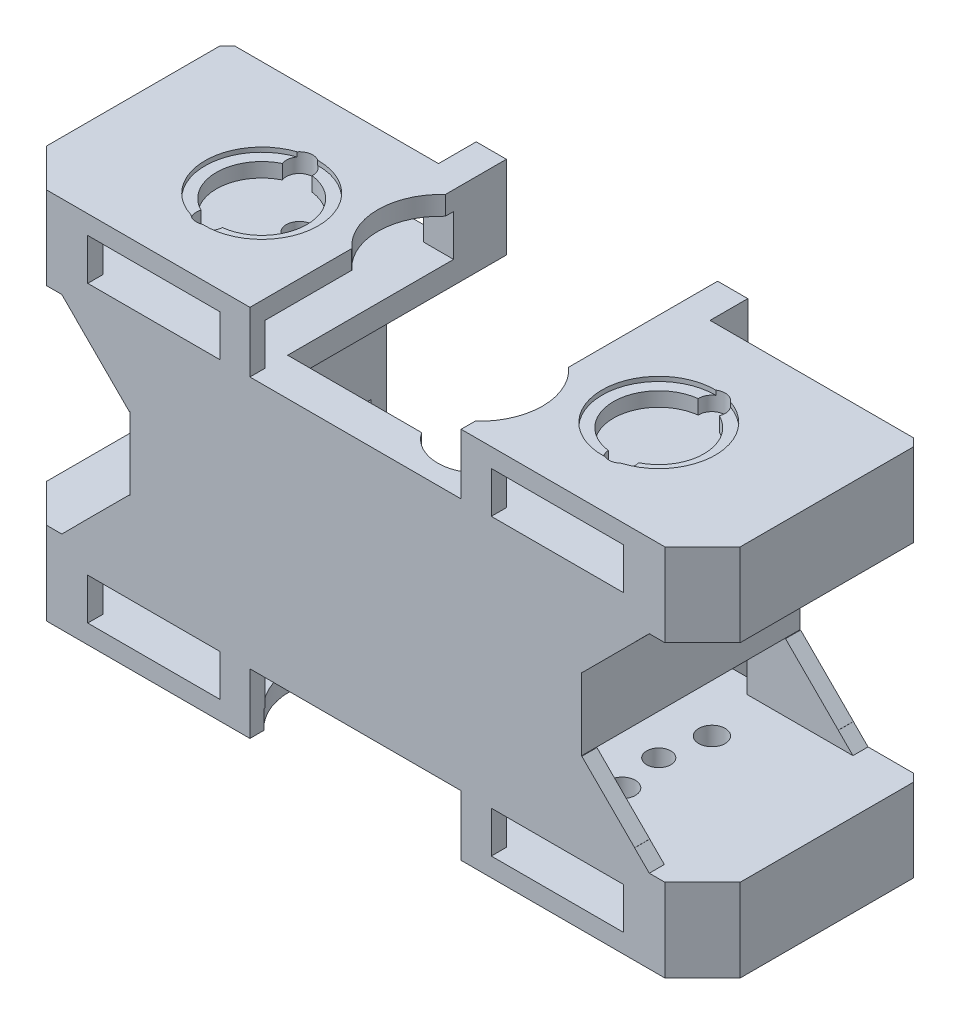
from build123d import *
from build123d.topology import SkipClean

# Parameters (mm, degrees)
BOSS_EXTRUDE1_DEPTH       = 2
BOSS_EXTRUDE2_DEPTH       = 25
BOSS_EXTRUDE2_DEPTH_BACK  = 2
SKETCH2_W                 = 4.4
SKETCH2_H                 = 9.5
SKETCH2_W_2               = 5
SKETCH2_H_2               = 9.59
SKETCH3_W                 = 23
SKETCH3_H                 = 13
SKETCH3_W_2               = 17.5
SKETCH3_H_2               = 6.5
BOSS_EXTRUDE3_DEPTH       = 2
SKETCH4_W                 = 23
SKETCH4_H                 = 2.5
SKETCH4_W_2               = 32
SKETCH4_H_2               = 3
BOSS_EXTRUDE4_DEPTH       = 27
BOSS_EXTRUDE5_DEPTH       = 2
CHAMFER5_SIZE             = 5
CHAMFER6_SIZE             = 7
BOSS_EXTRUDE6_DEPTH       = 5.5
BOSS_EXTRUDE7_DEPTH       = 2.5
SKETCH8_W                 = 26
SKETCH8_H                 = 5.5
CUT_EXTRUDE1_DEPTH        = 59.801041657
BOSS_EXTRUDE8_DEPTH       = 5.5
BOSS_EXTRUDE9_DEPTH       = 2.5
SKETCH11_W                = 26
SKETCH11_H                = 5.5
CUT_EXTRUDE2_DEPTH        = 2
SKETCH12_R                = 0.75
CUT_EXTRUDE3_DEPTH        = 5
CUT_EXTRUDE4_START        = -5
SKETCH13_R                = 0.75
CUT_EXTRUDE4_DEPTH        = 5
CHAMFER7_SIZE             = 1.94
SKETCH14_R                = 0.75
CUT_EXTRUDE5_DEPTH        = 5
CUT_EXTRUDE6_START        = -5
SKETCH15_R                = 0.75
CUT_EXTRUDE6_DEPTH        = 5
CUT_EXTRUDE7_REACH        = 74.768
SKETCH16_R                = 1.75
CUT_EXTRUDE8_START        = -11
SKETCH17_R                = 1.75
CUT_EXTRUDE8_DEPTH        = 11
CUT_EXTRUDE9_DEPTH        = 59.801041657
SKETCH19_R                = 6
CUT_EXTRUDE10_DEPTH       = 5
CUT_EXTRUDE11_START       = -5
SKETCH20_R                = 6
CUT_EXTRUDE11_DEPTH       = 5
SKETCH21_R                = 1.6
CUT_EXTRUDE12_DEPTH       = 5
CUT_EXTRUDE13_START       = -5
SKETCH22_R                = 1.6
CUT_EXTRUDE13_DEPTH       = 5
SKETCH24_R                = 7.5
CUT_EXTRUDE15_DEPTH       = 0.6
CUT_EXTRUDE16_START       = -0.6
SKETCH25_R                = 7.5
CUT_EXTRUDE16_DEPTH       = 0.6
SKETCH28_W                = 4
SKETCH28_H                = 11
BOSS_EXTRUDE12_DEPTH      = 5
SKETCH29_R                = 0.75
CUT_EXTRUDE17_DEPTH       = 5
CHAMFER9_SIZE             = 3
CHAMFER10_SIZE            = 1
SKETCH30_W                = 4.4
SKETCH30_H                = 9.5
CUT_EXTRUDE18_DEPTH       = 1
CUT_EXTRUDE19_DEPTH       = 2.5
CUT_EXTRUDE20_DEPTH       = 2.5
SKETCH33_W                = 4.4
SKETCH33_H                = 9.5
CUT_EXTRUDE21_DEPTH       = 24
BOSS_EXTRUDE13_DEPTH      = 3
BOSS_EXTRUDE13_DEPTH_BACK = 2
SKETCH34_W                = 28
SKETCH34_H                = 3
SKETCH35_R                = 5.5
CUT_EXTRUDE22_DEPTH       = 68.987131135
SKETCH36_R                = 5.5
CUT_EXTRUDE23_DEPTH       = 3


with BuildPart() as part:
    # Sketch1 → Boss-Extrude1 (new body)
    with BuildSketch(Plane.XY):
        Polygon((-37, 13.75), (37, 13.75), (37, 4.795), (24.925, 4.795), (24.925, -4.795), (37, -4.795), (37, -13.75), (-37, -13.75), (-37, -4.795), (-24.925, -4.795), (-24.925, 4.795), (-37, 4.795), align=None)
    extrude(amount=BOSS_EXTRUDE1_DEPTH)

    # Sketch2 → Boss-Extrude2 (add, two sides: drawn at the far end of the back side and taken through both)
    with BuildSketch(Plane(origin=(0, 0, 0), x_dir=(-1, 0, 0), z_dir=(0, 0, -1)).offset(-BOSS_EXTRUDE2_DEPTH_BACK)):
        Rectangle(SKETCH2_W, SKETCH2_H)
        with Locations((27.425, 0)):
            Rectangle(SKETCH2_W_2, SKETCH2_H_2)
        with Locations((-27.425, 0)):
            Rectangle(SKETCH2_W_2, SKETCH2_H_2)
    extrude(amount=BOSS_EXTRUDE2_DEPTH + BOSS_EXTRUDE2_DEPTH_BACK)

    # Sketch3 → Boss-Extrude3 (add)
    # profile 1 of 4: a face of its own
    with BuildSketch(Plane.XY.offset(2)):
        with Locations((-25.5, 18.25)):
            Rectangle(SKETCH3_W, SKETCH3_H)
        with Locations((-26.75, 19)):
            Rectangle(SKETCH3_W_2, SKETCH3_H_2, mode=Mode.SUBTRACT)
    # profile 2 of 4: a face of its own
    with BuildSketch(Plane.XY.offset(2)):
        with Locations((25.5, 18.25)):
            Rectangle(SKETCH3_W, SKETCH3_H)
        with Locations((26.75, 19)):
            Rectangle(SKETCH3_W_2, SKETCH3_H_2, mode=Mode.SUBTRACT)
    # profile 3 of 4: a face of its own
    with BuildSketch(Plane.XY.offset(2)):
        with Locations((25.5, -18.25)):
            Rectangle(SKETCH3_W, SKETCH3_H)
        with Locations((26.75, -19)):
            Rectangle(SKETCH3_W_2, SKETCH3_H_2, mode=Mode.SUBTRACT)
    # profile 4 of 4: a face of its own
    with BuildSketch(Plane.XY.offset(2)):
        with Locations((-25.5, -18.25)):
            Rectangle(SKETCH3_W, SKETCH3_H)
        with Locations((-26.75, -19)):
            Rectangle(SKETCH3_W_2, SKETCH3_H_2, mode=Mode.SUBTRACT)
    extrude(amount=-BOSS_EXTRUDE3_DEPTH)

    # Sketch4 → Boss-Extrude4 (add)
    with BuildSketch(Plane.XY.offset(2)):
        with Locations((25.5, 23.5)):
            Rectangle(SKETCH4_W, SKETCH4_H)
        with Locations((30, 15.25)):
            Rectangle(SKETCH4_W_2, SKETCH4_H_2)
        with Locations((-30, 15.25)):
            Rectangle(SKETCH4_W_2, SKETCH4_H_2)
        with Locations((-25.5, 23.5)):
            Rectangle(SKETCH4_W, SKETCH4_H)
        with Locations((-25.5, -23.5)):
            Rectangle(SKETCH4_W, SKETCH4_H)
        with Locations((25.5, -23.5)):
            Rectangle(SKETCH4_W, SKETCH4_H)
        with Locations((-30, -15.25)):
            Rectangle(SKETCH4_W_2, SKETCH4_H_2)
        with Locations((30, -15.25)):
            Rectangle(SKETCH4_W_2, SKETCH4_H_2)
    extrude(amount=-BOSS_EXTRUDE4_DEPTH)

    # Sketch5 → Boss-Extrude5 (add)
    with BuildSketch(Plane(origin=(0, 0, -25), x_dir=(-1, 0, 0), z_dir=(0, 0, -1))):
        Polygon((14, -13.75), (14, -24.75), (37, -24.75), (37, -16.75), (46, -16.75), (46, -13.75), (37, -13.75), (37, -4.795), (29.925, -4.795), (29.925, 4.795), (37, 4.795), (37, 13.75), (46, 13.75), (46, 16.75), (37, 16.75), (37, 24.75), (14, 24.75), (14, 13.75), (-14, 13.75), (-14, 24.75), (-37, 24.75), (-37, 16.75), (-46, 16.75), (-46, 13.75), (-37, 13.75), (-37, 4.795), (-29.925, 4.795), (-29.925, -4.795), (-37, -4.795), (-37, -13.75), (-46, -13.75), (-46, -16.75), (-37, -16.75), (-37, -24.75), (-14, -24.75), (-14, -13.75), align=None)
    extrude(amount=BOSS_EXTRUDE5_DEPTH)

    # Chamfer5
    chamfer5_edges = [part.edges().sort_by_distance(p)[0] for p in [
        (-46, 15.25, 2),
        (46, 15.25, 2),
        (46, -15.25, 2),
        (-46, -15.25, 2),
    ]]
    chamfer(chamfer5_edges, length=CHAMFER5_SIZE)

    # Chamfer6
    chamfer6_edges = [part.edges().sort_by_distance(p)[0] for p in [
        (37, 4.795, 1),
        (37, -4.795, 1),
        (-37, -4.795, 1),
        (-37, 4.795, 1),
        (-37, -4.795, -26),
        (-37, 4.795, -26),
        (37, 4.795, -26),
        (37, -4.795, -26),
    ]]
    chamfer(chamfer6_edges, length=CHAMFER6_SIZE)

    # Sketch6 → Boss-Extrude6 (add)
    with BuildSketch(Plane(origin=(0, 16.75, 0), x_dir=(1, 0, 0), z_dir=(0, 1, 0))):
        Polygon((-37, 0), (-37, -2), (-41, -2), (-46, 3), (-46, 27), (-37, 27), (-37, 25), (-44, 25), (-44, 3.828427125), (-40.171572875, 0), align=None)
        Polygon((40.171572875, 0), (37, 0), (37, -2), (41, -2), (46, 3), (46, 27), (37, 27), (37, 25), (44, 25), (44, 3.828427125), align=None)
    extrude(amount=BOSS_EXTRUDE6_DEPTH)

    # Sketch7 → Boss-Extrude7 (add)
    with BuildSketch(Plane(origin=(0, 22.25, 0), x_dir=(1, 0, 0), z_dir=(0, 1, 0))):
        Polygon((-46, 3), (-46, 27), (-37, 27), (-37, -2), (-41, -2), align=None)
        Polygon((46, 3), (41, -2), (37, -2), (37, 27), (46, 27), align=None)
    extrude(amount=BOSS_EXTRUDE7_DEPTH)

    # Sketch8 → Cut-Extrude1 (cut, through all)
    with BuildSketch(Plane.XY.offset(-25)):
        with Locations((-31, 19.5)):
            Rectangle(SKETCH8_W, SKETCH8_H)
        with Locations((31, 19.5)):
            Rectangle(SKETCH8_W, SKETCH8_H)
    extrude(amount=-CUT_EXTRUDE1_DEPTH, mode=Mode.SUBTRACT)

    # Sketch9 → Boss-Extrude8 (add)
    with BuildSketch(Plane.XZ.offset(16.75)):
        Polygon((41, 2), (37, 2), (37, 0), (40.171572875, 0), (44, -3.828427125), (44, -25), (37, -25), (37, -27), (46, -27), (46, -3), align=None)
        Polygon((-41, 2), (-46, -3), (-46, -27), (-37, -27), (-37, -25), (-44, -25), (-44, -3.828427125), (-40.171572875, 0), (-37, 0), (-37, 2), align=None)
    extrude(amount=BOSS_EXTRUDE8_DEPTH)

    # Sketch10 → Boss-Extrude9 (add)
    with BuildSketch(Plane.XZ.offset(22.25)):
        Polygon((46, -3), (41, 2), (37, 2), (37, -27), (46, -27), align=None)
        Polygon((-46, -3), (-46, -27), (-37, -27), (-37, 2), (-41, 2), align=None)
    extrude(amount=BOSS_EXTRUDE9_DEPTH)

    # Sketch11 → Cut-Extrude2 (cut)
    with BuildSketch(Plane(origin=(0, 0, -27), x_dir=(-1, 0, 0), z_dir=(0, 0, -1))):
        with Locations((31, -19.5)):
            Rectangle(SKETCH11_W, SKETCH11_H)
        with Locations((-31, -19.5)):
            Rectangle(SKETCH11_W, SKETCH11_H)
    extrude(amount=-CUT_EXTRUDE2_DEPTH, mode=Mode.SUBTRACT)

    # Sketch12 → Cut-Extrude3 (cut)
    with BuildSketch(Plane.XZ.offset(4.75)):
        with Locations(Location((-0.16, -17.91, 0), (0, 0, 270))):
            Circle(SKETCH12_R)
        with Locations(Location((0.16, -6, 0), (0, 0, 270))):
            Circle(SKETCH12_R)
    extrude(amount=-CUT_EXTRUDE3_DEPTH, mode=Mode.SUBTRACT)

    # Sketch13 → Cut-Extrude4 (cut)
    with BuildSketch(Plane(origin=(0, 4.75, 0), x_dir=(1, 0, 0), z_dir=(0, 1, 0)).offset(CUT_EXTRUDE4_START)):
        with Locations(Location((0.16, 6, 0), (0, 0, 90))):
            Circle(SKETCH13_R)
        with Locations(Location((-0.16, 17.91, 0), (0, 0, 90))):
            Circle(SKETCH13_R)
    extrude(amount=CUT_EXTRUDE4_DEPTH, mode=Mode.SUBTRACT)

    # Chamfer7
    chamfer7_edges = [part.edges().sort_by_distance(p)[0] for p in [
        (-37, 13.75, 1),
        (37, 13.75, 1),
        (37, -13.75, 1),
        (-37, -13.75, 1),
        (-37, -13.75, -26),
        (-37, 13.75, -26),
        (37, 13.75, -26),
        (37, -13.75, -26),
    ]]
    chamfer(chamfer7_edges, length=CHAMFER7_SIZE)

    # Sketch14 → Cut-Extrude5 (cut)
    with BuildSketch(Plane(origin=(0, 4.795, 0), x_dir=(1, 0, 0), z_dir=(0, 1, 0))):
        with Locations(Location((27.34, 6, 0), (0, 0, 180))):
            Circle(SKETCH14_R)
        with Locations(Location((27.34, 17.91, 0), (0, 0, 180))):
            Circle(SKETCH14_R)
        with Locations((-27.34, 17.91)):
            Circle(SKETCH14_R)
        with Locations((-27.34, 6)):
            Circle(SKETCH14_R)
    extrude(amount=-CUT_EXTRUDE5_DEPTH, mode=Mode.SUBTRACT)

    # Sketch15 → Cut-Extrude6 (cut)
    with SkipClean():  # the faces are left unmerged after this step: merging them gives an invalid solid
        with BuildSketch(Plane.XZ.offset(4.795).offset(CUT_EXTRUDE6_START)):
            with Locations(Location((27.34, -17.91, 0), (0, 0, 180))):
                Circle(SKETCH15_R)
            with Locations(Location((27.34, -6, 0), (0, 0, 180))):
                Circle(SKETCH15_R)
            with Locations(Location((-27.34, -6, 0), (0, 0, 180))):
                Circle(SKETCH15_R)
            with Locations(Location((-27.34, -17.91, 0), (0, 0, 180))):
                Circle(SKETCH15_R)
        extrude(amount=CUT_EXTRUDE6_DEPTH, mode=Mode.SUBTRACT)
    add(part.part.scale(1), mode=Mode.REPLACE)  # the faces are merged on a copy

    # Cut-Extrude7: up to this face of the body (flat: up to its plane)
    cut_extrude7_end = Plane(part.part.faces().sort_by_distance((-30.212060379, 13.75, -12.696651711))[0])
    # Sketch16 → Cut-Extrude7 (cut, up to the picked face)
    with BuildSketch(Plane(origin=(0, 24.75, 0), x_dir=(1, 0, 0), z_dir=(0, 1, 0)), mode=Mode.PRIVATE) as cut_extrude7_sk1:
        with Locations(Location((27.34, 17.91, 0), (0, 0, 270))):
            Circle(SKETCH16_R)
    cut_extrude7_tool1 = split(extrude(cut_extrude7_sk1.sketch, amount=-CUT_EXTRUDE7_REACH, mode=Mode.PRIVATE), bisect_by=cut_extrude7_end, keep=Keep.BOTH, mode=Mode.PRIVATE)
    # Sketch16 → Cut-Extrude7 (cut, up to the picked face)
    with BuildSketch(Plane(origin=(0, 24.75, 0), x_dir=(1, 0, 0), z_dir=(0, 1, 0)), mode=Mode.PRIVATE) as cut_extrude7_sk2:
        with Locations(Location((27.34, 6, 0), (0, 0, 270))):
            Circle(SKETCH16_R)
    cut_extrude7_tool2 = split(extrude(cut_extrude7_sk2.sketch, amount=-CUT_EXTRUDE7_REACH, mode=Mode.PRIVATE), bisect_by=cut_extrude7_end, keep=Keep.BOTH, mode=Mode.PRIVATE)
    # Sketch16 → Cut-Extrude7 (cut, up to the picked face)
    with BuildSketch(Plane(origin=(0, 24.75, 0), x_dir=(1, 0, 0), z_dir=(0, 1, 0)), mode=Mode.PRIVATE) as cut_extrude7_sk3:
        with Locations(Location((-27.34, 6, 0), (0, 0, 270))):
            Circle(SKETCH16_R)
    cut_extrude7_tool3 = split(extrude(cut_extrude7_sk3.sketch, amount=-CUT_EXTRUDE7_REACH, mode=Mode.PRIVATE), bisect_by=cut_extrude7_end, keep=Keep.BOTH, mode=Mode.PRIVATE)
    # Sketch16 → Cut-Extrude7 (cut, up to the picked face)
    with BuildSketch(Plane(origin=(0, 24.75, 0), x_dir=(1, 0, 0), z_dir=(0, 1, 0)), mode=Mode.PRIVATE) as cut_extrude7_sk4:
        with Locations(Location((-27.34, 17.91, 0), (0, 0, 270))):
            Circle(SKETCH16_R)
    cut_extrude7_tool4 = split(extrude(cut_extrude7_sk4.sketch, amount=-CUT_EXTRUDE7_REACH, mode=Mode.PRIVATE), bisect_by=cut_extrude7_end, keep=Keep.BOTH, mode=Mode.PRIVATE)
    add(cut_extrude7_tool1.solids().sort_by(Axis((27.34, 24.75, -17.91), (0, -1, 0)))[0], mode=Mode.SUBTRACT)
    add(cut_extrude7_tool2.solids().sort_by(Axis((27.34, 24.75, -6), (0, -1, 0)))[0], mode=Mode.SUBTRACT)
    add(cut_extrude7_tool3.solids().sort_by(Axis((-27.34, 24.75, -6), (0, -1, 0)))[0], mode=Mode.SUBTRACT)
    add(cut_extrude7_tool4.solids().sort_by(Axis((-27.34, 24.75, -17.91), (0, -1, 0)))[0], mode=Mode.SUBTRACT)

    # Sketch17 → Cut-Extrude8 (cut)
    with BuildSketch(Plane.XZ.offset(24.75).offset(CUT_EXTRUDE8_START)):
        with Locations(Location((27.34, -6, 0), (0, 0, 90))):
            Circle(SKETCH17_R)
        with Locations(Location((27.34, -17.91, 0), (0, 0, 90))):
            Circle(SKETCH17_R)
        with Locations(Location((-27.34, -6, 0), (0, 0, 90))):
            Circle(SKETCH17_R)
        with Locations(Location((-27.34, -17.91, 0), (0, 0, 90))):
            Circle(SKETCH17_R)
    extrude(amount=CUT_EXTRUDE8_DEPTH, mode=Mode.SUBTRACT)

    # Sketch18 → Cut-Extrude9 (cut, through all)
    with BuildSketch(Plane.XY.offset(-25)):
        Polygon((-24.925, 0), (-24.925, -13.75), (24.925, -13.75), (24.925, 13.75), (-24.925, 13.75), align=None)
    extrude(amount=-CUT_EXTRUDE9_DEPTH, mode=Mode.SUBTRACT)

    # Sketch19 → Cut-Extrude10 (cut)
    with BuildSketch(Plane(origin=(0, 24.75, 0), x_dir=(1, 0, 0), z_dir=(0, 1, 0))):
        with Locations((26.319971496, 11.88)):
            Circle(SKETCH19_R)
        with Locations((-26.319971496, 11.88)):
            Circle(SKETCH19_R)
    extrude(amount=-CUT_EXTRUDE10_DEPTH, mode=Mode.SUBTRACT)

    # Sketch20 → Cut-Extrude11 (cut)
    with BuildSketch(Plane.XZ.offset(24.75).offset(CUT_EXTRUDE11_START)):
        with Locations((-26.319971496, -11.88)):
            Circle(SKETCH20_R)
        with Locations((26.319971496, -11.88)):
            Circle(SKETCH20_R)
    extrude(amount=CUT_EXTRUDE11_DEPTH, mode=Mode.SUBTRACT)

    # Sketch21 → Cut-Extrude12 (cut)
    with BuildSketch(Plane(origin=(0, 16.75, 0), x_dir=(1, 0, 0), z_dir=(0, 1, 0))):
        with Locations(Location((-26.319971496, 11.88, 0), (0, 0, 270))):
            Circle(SKETCH21_R)
        with Locations(Location((26.319971496, 11.88, 0), (0, 0, 270))):
            Circle(SKETCH21_R)
    extrude(amount=-CUT_EXTRUDE12_DEPTH, mode=Mode.SUBTRACT)

    # Sketch22 → Cut-Extrude13 (cut)
    with BuildSketch(Plane.XZ.offset(16.75).offset(CUT_EXTRUDE13_START)):
        with Locations(Location((26.319971496, -11.88, 0), (0, 0, 90))):
            Circle(SKETCH22_R)
        with Locations(Location((-26.319971496, -11.88, 0), (0, 0, 90))):
            Circle(SKETCH22_R)
    extrude(amount=CUT_EXTRUDE13_DEPTH, mode=Mode.SUBTRACT)

    # Sketch24 → Cut-Extrude15 (cut)
    with BuildSketch(Plane(origin=(0, 24.75, 0), x_dir=(1, 0, 0), z_dir=(0, 1, 0))):
        with Locations((26.319971496, 11.88)):
            Circle(SKETCH24_R)
        with Locations((-26.319971496, 11.88)):
            Circle(SKETCH24_R)
    extrude(amount=-CUT_EXTRUDE15_DEPTH, mode=Mode.SUBTRACT)

    # Sketch25 → Cut-Extrude16 (cut)
    with BuildSketch(Plane.XZ.offset(24.75).offset(CUT_EXTRUDE16_START)):
        with Locations((-26.319971496, -11.88)):
            Circle(SKETCH25_R)
        with Locations((26.319971496, -11.88)):
            Circle(SKETCH25_R)
    extrude(amount=CUT_EXTRUDE16_DEPTH, mode=Mode.SUBTRACT)

    # Sketch28 → Boss-Extrude12 (add)
    with BuildSketch(Plane(origin=(0, 0, -27), x_dir=(-1, 0, 0), z_dir=(0, 0, -1))):
        with Locations((-16, 19.25)):
            Rectangle(SKETCH28_W, SKETCH28_H)
        with Locations((16, 19.25)):
            Rectangle(SKETCH28_W, SKETCH28_H)
        with Locations((16, -19.25)):
            Rectangle(SKETCH28_W, SKETCH28_H)
        with Locations((-16, -19.25)):
            Rectangle(SKETCH28_W, SKETCH28_H)
    extrude(amount=BOSS_EXTRUDE12_DEPTH)

    # Sketch29 → Cut-Extrude17 (cut)
    with BuildSketch(Plane(origin=(0, 0, -32), x_dir=(-1, 0, 0), z_dir=(0, 0, -1))):
        with Locations((-16, 19.75)):
            Circle(SKETCH29_R)
        with Locations(Location((16, 19.75, 0), (0, 0, 180))):
            Circle(SKETCH29_R)
        with Locations((16, -19.75)):
            Circle(SKETCH29_R)
        with Locations(Location((-16, -19.75, 0), (0, 0, 180))):
            Circle(SKETCH29_R)
    extrude(amount=-CUT_EXTRUDE17_DEPTH, mode=Mode.SUBTRACT)

    # Chamfer9
    chamfer9_edges = [part.edges().sort_by_distance(p)[0] for p in [
        (14, -13.75, 1),
        (-14, -13.75, 1),
        (-14, 13.75, 1),
        (14, 13.75, 1),
    ]]
    chamfer(chamfer9_edges, length=CHAMFER9_SIZE - 0.0001)  # a hair under: the kernel refuses the full size

    # Chamfer10
    chamfer10_edges = [part.edges().sort_by_distance(p)[0] for p in [
        (-46, -19.25, -27),
        (-46, 19.25, -27),
        (46, 19.25, -27),
        (46, -19.25, -27),
    ]]
    chamfer(chamfer10_edges, length=CHAMFER10_SIZE)

    # Sketch30 → Cut-Extrude18 (cut)
    with BuildSketch(Plane(origin=(0, 0, -25), x_dir=(-1, 0, 0), z_dir=(0, 0, -1))):
        Rectangle(SKETCH30_W, SKETCH30_H)
    extrude(amount=-CUT_EXTRUDE18_DEPTH, mode=Mode.SUBTRACT)

    # Sketch31 → Cut-Extrude19 (cut)
    with BuildSketch(Plane.XZ.offset(24.75)):
        with BuildLine():
            ThreePointArc((0, -5.052802415), (-16.74, -6.055), (0, -7.057197585))
            ThreePointArc((0, -7.057197585), (0.06, -6.055), (0, -5.052802415))
        make_face()
        with BuildLine():
            ThreePointArc((0, -18.707197585), (16.74, -17.705), (0, -16.702802415))
            ThreePointArc((0, -16.702802415), (-0.06, -17.705), (0, -18.707197585))
        make_face()
    extrude(amount=-CUT_EXTRUDE19_DEPTH, mode=Mode.SUBTRACT)

    # Sketch32 → Cut-Extrude20 (cut)
    with BuildSketch(Plane(origin=(0, 24.75, 0), x_dir=(1, 0, 0), z_dir=(0, 1, 0))):
        with BuildLine():
            ThreePointArc((0, 18.707197585), (0.06, 17.705), (0, 16.702802415))
            ThreePointArc((0, 16.702802415), (-16.74, 17.705), (0, 18.707197585))
        make_face()
        with BuildLine():
            ThreePointArc((0, 7.057197585), (16.74, 6.055), (0, 5.052802415))
            ThreePointArc((0, 5.052802415), (-0.06, 6.055), (0, 7.057197585))
        make_face()
    extrude(amount=-CUT_EXTRUDE20_DEPTH, mode=Mode.SUBTRACT)

    # Sketch33 → Cut-Extrude21 (cut)
    with BuildSketch(Plane(origin=(0, 0, -24), x_dir=(-1, 0, 0), z_dir=(0, 0, -1))):
        Rectangle(SKETCH33_W, SKETCH33_H)
    extrude(amount=-CUT_EXTRUDE21_DEPTH, mode=Mode.SUBTRACT)

    # Sketch34 → Boss-Extrude13 (add, two sides: drawn at the far end of the back side and taken through both)
    with BuildSketch(Plane(origin=(0, 0, 0), x_dir=(-1, 0, 0), z_dir=(0, 0, -1)).offset(-BOSS_EXTRUDE13_DEPTH_BACK)):
        with Locations((0, 15.25)):
            Rectangle(SKETCH34_W, SKETCH34_H)
        with Locations((0, -15.25)):
            Rectangle(SKETCH34_W, SKETCH34_H)
    extrude(amount=BOSS_EXTRUDE13_DEPTH + BOSS_EXTRUDE13_DEPTH_BACK)

    # Sketch35 → Cut-Extrude22 (cut, through all)
    with BuildSketch(Plane.XZ.offset(-13.75)):
        with Locations((8.34, -6.055)):
            Circle(SKETCH35_R)
    extrude(amount=-CUT_EXTRUDE22_DEPTH, mode=Mode.SUBTRACT)

    # Sketch36 → Cut-Extrude23 (cut)
    with BuildSketch(Plane.XZ.offset(16.75)):
        with Locations((-8.34, -6.055)):
            Circle(SKETCH36_R)
    extrude(amount=-CUT_EXTRUDE23_DEPTH, mode=Mode.SUBTRACT)


solid = part.part
